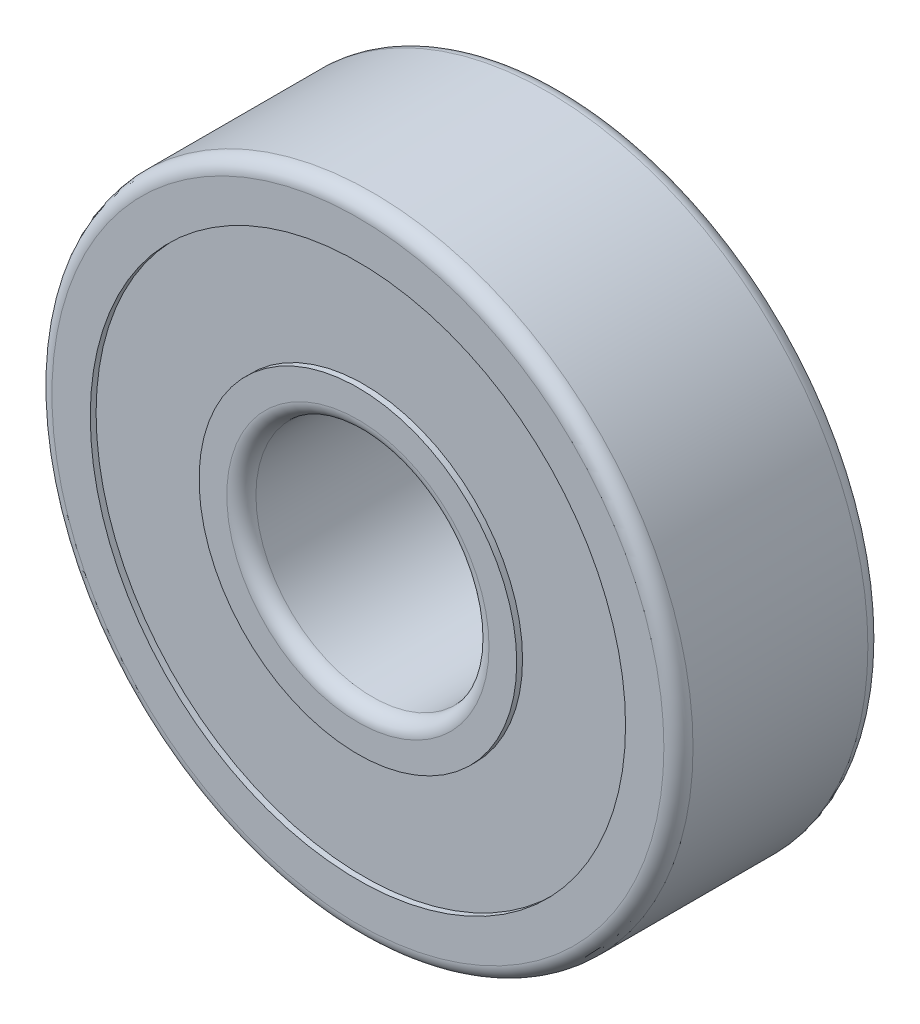
from build123d import *

# Parameters (mm, degrees)
SZKIC1_R                    = 11
SZKIC1_R_2                  = 4
DODANIE_WYCI_GNI_CIE1_DEPTH = 3.5
SZKIC2_R                    = 9.184724544
SZKIC2_R_2                  = 5.450254851
WYTNIJ_WYCI_GNI_CIE1_DEPTH  = 0.2
ZAOKR_GLENIE1_R             = 0.5


with BuildPart() as part:
    # Szkic1 → Dodanie-wyciągnięcie1 (new, symmetric)
    with BuildSketch(Plane.XY):
        Circle(SZKIC1_R)
        Circle(SZKIC1_R_2, mode=Mode.SUBTRACT)
    extrude(amount=DODANIE_WYCI_GNI_CIE1_DEPTH, both=True)

    # Szkic2 → Wytnij-wyciągnięcie1 (cut)
    with BuildSketch(Plane.XY.offset(3.5)):
        Circle(SZKIC2_R)
        Circle(SZKIC2_R_2, mode=Mode.SUBTRACT)
    wytnij_wyci_gni_cie1 = extrude(amount=-WYTNIJ_WYCI_GNI_CIE1_DEPTH, mode=Mode.SUBTRACT)

    # Lustro1: Wytnij-wyciągnięcie1 across plane
    add(wytnij_wyci_gni_cie1.mirror(Plane.XY), mode=Mode.SUBTRACT)

    # Zaokrąglenie1
    zaokr_glenie1_edges = [part.edges().sort_by_distance(p)[0] for p in [
        (-4, 0, 3.5),
        (-11, 0, 3.5),
        (-11, 0, -3.5),
        (-4, 0, -3.5),
    ]]
    fillet(zaokr_glenie1_edges, radius=ZAOKR_GLENIE1_R)


solid = part.part
